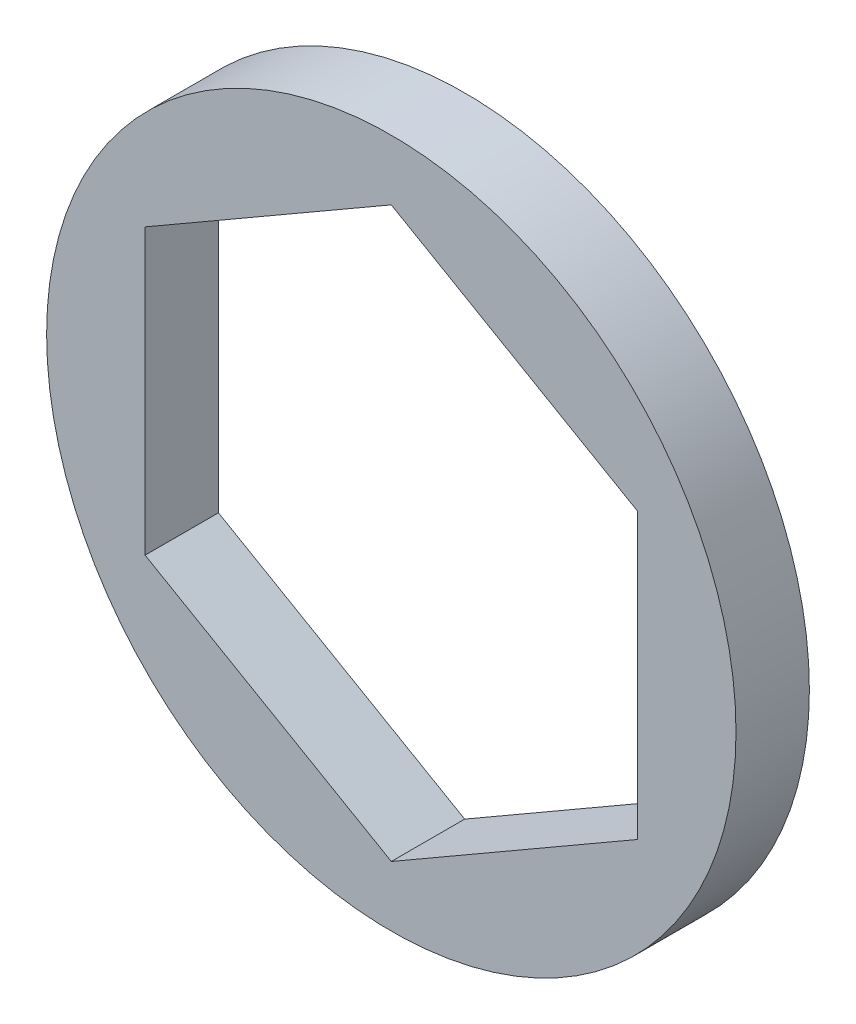
from build123d import *

# Parameters (mm, degrees)
SKETCH1_R           = 8.89
BOSS_EXTRUDE1_DEPTH = 0.94615


with BuildPart() as part:
    # Sketch1 → Boss-Extrude1 (new, symmetric)
    with BuildSketch(Plane.XY):
        Circle(SKETCH1_R)
        Polygon((0, 7.332348419), (-6.35, 3.666174209), (-6.35, -3.666174209), (0, -7.332348419), (6.35, -3.666174209), (6.35, 3.666174209), align=None, mode=Mode.SUBTRACT)
    extrude(amount=BOSS_EXTRUDE1_DEPTH, both=True)


solid = part.part
